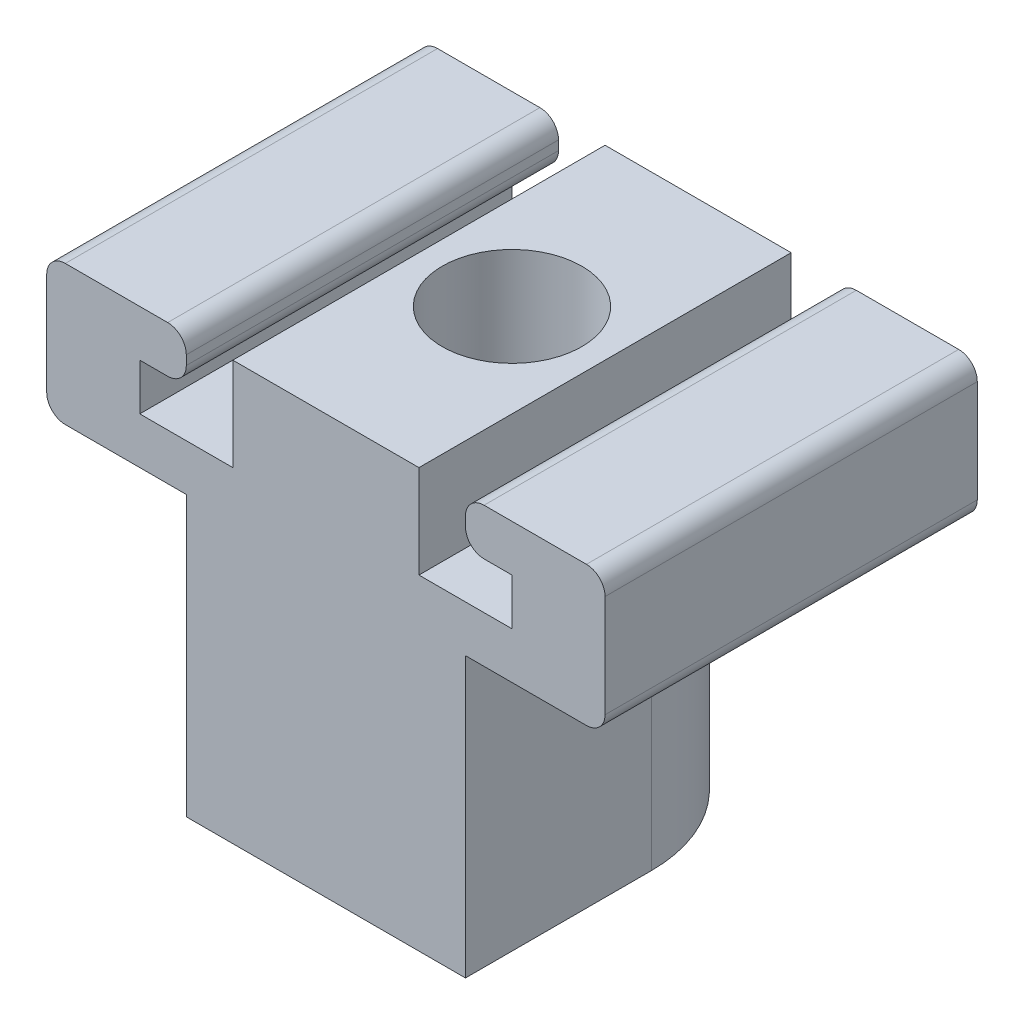
from build123d import *

# Parameters (mm, degrees)
SKETCH1_W           = 38.1
SKETCH1_H           = 25.4
BOSS_EXTRUDE1_DEPTH = 9.525
CUT_EXTRUDE1_REACH  = 35.148
BOSS_EXTRUDE2_DEPTH = 19.05
CUT_EXTRUDE3_REACH  = 38.616
SKETCH5_R           = 4.7625
SKETCH4_R           = 7.14375
CUT_EXTRUDE2_DEPTH  = 19.05
FILLET2_R           = 1.27


with BuildPart() as part:
    # Sketch1 → Boss-Extrude1 (new body)
    with BuildSketch(Plane(origin=(0, 0, 0), x_dir=(1, 0, 0), z_dir=(0, 1, 0))):
        Rectangle(SKETCH1_W, SKETCH1_H)
    extrude(amount=BOSS_EXTRUDE1_DEPTH)

    # Sketch2 → Cut-Extrude1 (cut, up to next)
    with BuildSketch(Plane(origin=(0, 0, -12.7), x_dir=(-1, 0, 0), z_dir=(0, 0, -1)), mode=Mode.PRIVATE) as cut_extrude1_sk1:
        Polygon((-9.525, 9.525), (-9.525, 6.35), (-12.7, 6.35), (-12.7, 3.175), (-6.35, 3.175), (-6.35, 9.525), align=None)
    cut_extrude1_tool1 = extrude(cut_extrude1_sk1.sketch, amount=-CUT_EXTRUDE1_REACH, mode=Mode.PRIVATE) & part.part
    cut_extrude1 = cut_extrude1_tool1.solids().sort_by_distance((8.995833, 5.820833, -12.7))[0]
    add(cut_extrude1, mode=Mode.SUBTRACT)

    # Mirror1: Cut-Extrude1 across plane
    add(cut_extrude1.mirror(Plane(origin=(0, 0, 0), x_dir=(0, 0, 1), z_dir=(1, 0, 0))), mode=Mode.SUBTRACT)

    # Sketch3 → Boss-Extrude2 (add)
    with BuildSketch(Plane.XZ):
        with BuildLine():
            Line((9.525, 0), (9.525, 12.7))
            Line((9.525, 12.7), (-9.525, 12.7))
            Line((-9.525, 12.7), (-9.525, 0))
            ThreePointArc((-9.525, 0), (0, -9.525), (9.525, 0))
        make_face()
    extrude(amount=BOSS_EXTRUDE2_DEPTH)

    # Sketch5 → Cut-Extrude3 (cut, up to next)
    with BuildSketch(Plane(origin=(0, -19.05, 0), x_dir=(-1, 0, 0), z_dir=(0, -1, 0)), mode=Mode.PRIVATE) as cut_extrude3_sk1:
        Circle(SKETCH5_R)
    cut_extrude3_tool1 = extrude(cut_extrude3_sk1.sketch, amount=-CUT_EXTRUDE3_REACH, mode=Mode.PRIVATE) & part.part
    add(cut_extrude3_tool1.solids().sort_by_distance((0, -19.05, 0))[0], mode=Mode.SUBTRACT)

    # Sketch4 → Cut-Extrude2 (cut)
    with BuildSketch(Plane.XZ.offset(19.05)):
        Circle(SKETCH4_R)
    extrude(amount=-CUT_EXTRUDE2_DEPTH, mode=Mode.SUBTRACT)

    # Fillet2
    fillet2_edges = [part.edges().sort_by_distance(p)[0] for p in [
        (19.05, 0, 0),
        (-19.05, 0, 0),
        (-19.05, 9.525, 0),
        (19.05, 9.525, 0),
        (9.525, 6.35, 0),
        (9.525, 9.525, 0),
        (-9.525, 6.35, 0),
        (-9.525, 9.525, 0),
    ]]
    fillet(fillet2_edges, radius=FILLET2_R)


solid = part.part
